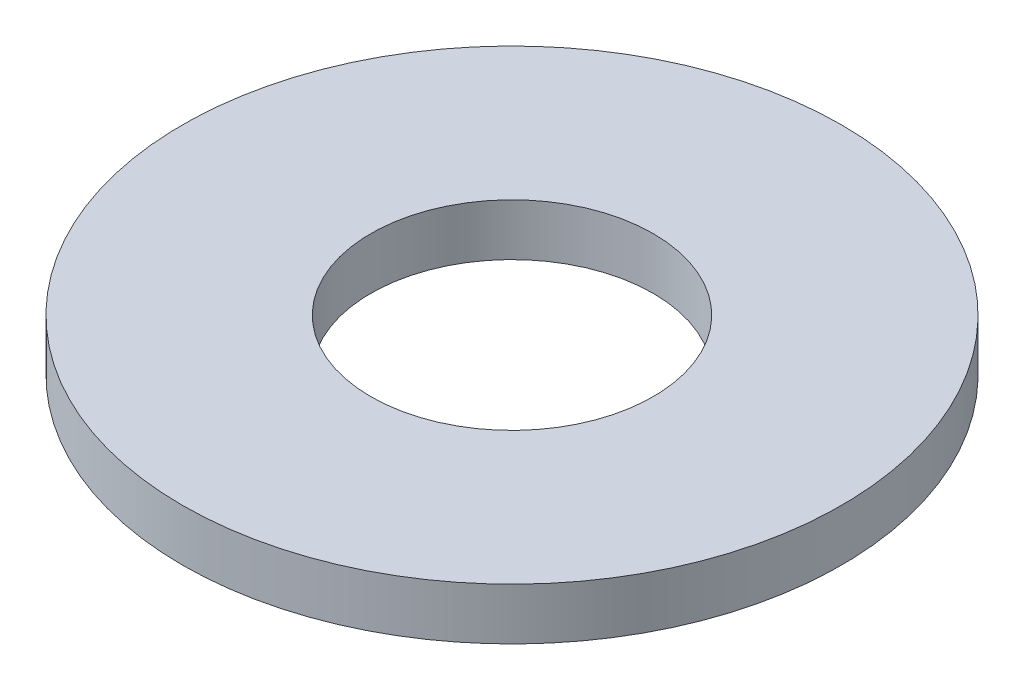
from build123d import *

# Parameters (mm, degrees)
SKETCH1_R           = 70
BOSS_EXTRUDE1_DEPTH = 11
SKETCH2_R           = 30
CUT_EXTRUDE1_DEPTH  = 100.604216778


with BuildPart() as part:
    # Sketch1 → Boss-Extrude1 (new body)
    with BuildSketch(Plane(origin=(0, 0, 0), x_dir=(1, 0, 0), z_dir=(0, 1, 0))):
        Circle(SKETCH1_R)
    extrude(amount=BOSS_EXTRUDE1_DEPTH)

    # Sketch2 → Cut-Extrude1 (cut, through all)
    with BuildSketch(Plane(origin=(0, 0, 0), x_dir=(1, 0, 0), z_dir=(0, 1, 0))):
        Circle(SKETCH2_R)
    extrude(amount=CUT_EXTRUDE1_DEPTH, mode=Mode.SUBTRACT)


solid = part.part
